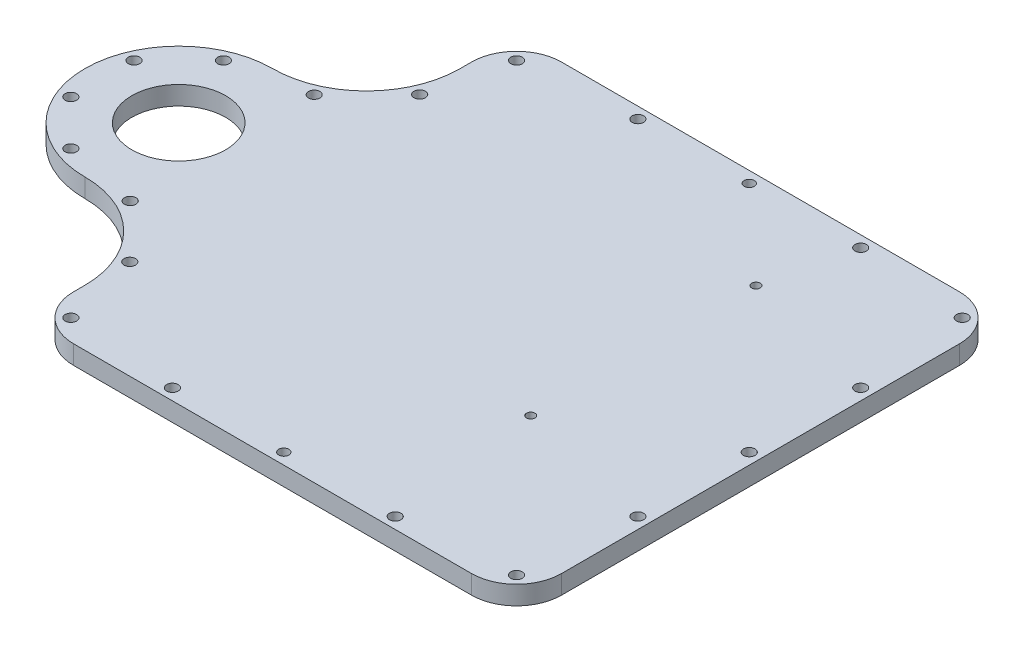
from build123d import *

# Parameters (mm, degrees)
BOSS_EXTRUDE1_DEPTH           = 4
BOSS_EXTRUDE1_DEPTH_BACK      = 1
FILLET1_START                 = -2
FILLET1_DEPTH                 = 7
FILLET1_START_2               = -1
FILLET1_2_DEPTH               = 5
SKETCH39_R                    = 12.5
CUT_EXTRUDE3_DEPTH            = 12.7
TAP_DRILL_FOR_4_40_TAP1_D     = 2.2606
TAP_DRILL_FOR_4_40_TAP1_DEPTH = 2.54
TAP_DRILL_FOR_4_40_TAP1_TIP   = 0.679152758
FILLET2_R                     = 12
SKETCH44_R                    = 1.524
SKETCH44_R_2                  = 1.35
CUT_EXTRUDE4_DEPTH            = 133.193040664
SKETCH47_R                    = 1.1303
CUT_EXTRUDE5_DEPTH            = 2.5


with BuildPart() as part:
    # Sketch1 → Boss-Extrude1 (new, two sides: drawn at the far end of the back side and taken through both)
    with BuildSketch(Plane(origin=(0, 0, 0), x_dir=(1, 0, 0), z_dir=(0, 1, 0)).offset(-BOSS_EXTRUDE1_DEPTH_BACK)):
        Polygon((-65, 25), (-65, 65), (65, 65), (65, -65), (-65, -65), (-65, -25), (-115, -25), (-115, 25), align=None)
    extrude(amount=BOSS_EXTRUDE1_DEPTH + BOSS_EXTRUDE1_DEPTH_BACK)

    # Fillet1: read off the stored shape, not the designer's step
    # Fillet1 outline → Fillet1 (cut)
    with BuildSketch(Plane(origin=(0, 0, 0), x_dir=(1, 0, 0), z_dir=(0, 1, 0)).offset(FILLET1_START)):
        with BuildLine():
            ThreePointArc((-90, -25), (-107.67766953, -17.67766953), (-115, 0))
            Line((-115, 0), (-115, -25))
            Line((-115, -25), (-90, -25))
        make_face()
        with BuildLine():
            ThreePointArc((-115, 0), (-107.67766953, 17.67766953), (-90, 25))
            Line((-90, 25), (-115, 25))
            Line((-115, 25), (-115, 0))
        make_face()
    extrude(amount=FILLET1_DEPTH, mode=Mode.SUBTRACT)

    # Fillet1 2 outline → Fillet1 2 (add)
    with BuildSketch(Plane(origin=(0, 0, 0), x_dir=(1, 0, 0), z_dir=(0, 1, 0)).offset(FILLET1_START_2)):
        with BuildLine():
            Line((-65, 25), (-65, 50))
            ThreePointArc((-65, 50), (-72.32233047, 32.32233047), (-90, 25))
            Line((-90, 25), (-65, 25))
        make_face()
        with BuildLine():
            Line((-65, -25), (-90, -25))
            ThreePointArc((-90, -25), (-72.32233047, -32.32233047), (-65, -50))
            Line((-65, -50), (-65, -25))
        make_face()
    extrude(amount=FILLET1_2_DEPTH)

    # Sketch39 → Cut-Extrude3 (cut)
    with BuildSketch(Plane.XZ.offset(1)):
        with Locations(Location((-90, 0, 0), (0, 0, 270))):
            Circle(SKETCH39_R)
    extrude(amount=-CUT_EXTRUDE3_DEPTH, mode=Mode.SUBTRACT)

    # Tap Drill for #4-40 Tap1
    with Locations(Plane(origin=(0, -1, 0), x_dir=(-1, 0, 0), z_dir=(0, -1, 0))):
        with Locations((90, -22), (74.443650814, -15.556349186), (68, 0), (74.443650814, 15.556349186), (90, 22), (105.556349186, 15.556349186), (112, 0), (105.556349186, -15.556349186)):
            Hole(TAP_DRILL_FOR_4_40_TAP1_D / 2, depth=TAP_DRILL_FOR_4_40_TAP1_DEPTH)
            with Locations((0, 0, -(TAP_DRILL_FOR_4_40_TAP1_DEPTH + TAP_DRILL_FOR_4_40_TAP1_TIP / 2))):  # 118° drill point
                Cone(0, TAP_DRILL_FOR_4_40_TAP1_D / 2, TAP_DRILL_FOR_4_40_TAP1_TIP, mode=Mode.SUBTRACT)

    # Fillet2
    fillet2_edges = [part.edges().sort_by_distance(p)[0] for p in [
        (65, 1.5, -65),
        (65, 1.5, 65),
        (-65, 1.5, 65),
        (-65, 1.5, -65),
    ]]
    fillet(fillet2_edges, radius=FILLET2_R)

    # Sketch44 → Cut-Extrude4 (cut, through all)
    with BuildSketch(Plane.XZ.offset(1)):
        with Locations(Location((-64.419035512, 38.615174316, 0), (0, 0, 270))):
            Circle(SKETCH44_R)
        with Locations(Location((-98.419035512, 20.325349715, 0), (0, 0, 270))):
            Circle(SKETCH44_R)
        with Locations(Location((-110.325349715, 8.419035512, 0), (0, 0, 270))):
            Circle(SKETCH44_R)
        with Locations(Location((-110.325349715, -8.419035512, 0), (0, 0, 270))):
            Circle(SKETCH44_R)
        with Locations(Location((-98.419035512, -20.325349715, 0), (0, 0, 270))):
            Circle(SKETCH44_R)
        with Locations(Location((-64.419035512, -38.615174316, 0), (0, 0, 270))):
            Circle(SKETCH44_R)
        with Locations(Location((-59.363961031, -59.363961031, 0), (0, 0, 270))):
            Circle(SKETCH44_R)
        with Locations(Location((-29.681980515, -62, 0), (0, 0, 270))):
            Circle(SKETCH44_R)
        with Locations(Location((0, -62, 0), (0, 0, 270))):
            Circle(SKETCH44_R_2)
        with Locations(Location((29.681980515, -62, 0), (0, 0, 270))):
            Circle(SKETCH44_R)
        with Locations(Location((59.363961031, -59.363961031, 0), (0, 0, 270))):
            Circle(SKETCH44_R)
        with Locations(Location((62, -29.681980515, 0), (0, 0, 270))):
            Circle(SKETCH44_R)
        with Locations(Location((62, 0, 0), (0, 0, 270))):
            Circle(SKETCH44_R)
        with Locations(Location((62, 29.681980515, 0), (0, 0, 270))):
            Circle(SKETCH44_R)
        with Locations(Location((59.363961031, 59.363961031, 0), (0, 0, 270))):
            Circle(SKETCH44_R)
        with Locations(Location((29.681980515, 62, 0), (0, 0, 270))):
            Circle(SKETCH44_R)
        with Locations(Location((0, 62, 0), (0, 0, 270))):
            Circle(SKETCH44_R_2)
        with Locations(Location((-29.681980515, 62, 0), (0, 0, 270))):
            Circle(SKETCH44_R)
        with Locations(Location((-59.363961031, 59.363961031, 0), (0, 0, 270))):
            Circle(SKETCH44_R)
        with Locations(Location((-78.419035512, -24.507231191, 0), (0, 0, 270))):
            Circle(SKETCH44_R)
        with Locations(Location((-78.419035512, 24.507231191, 0), (0, 0, 270))):
            Circle(SKETCH44_R)
    extrude(amount=-CUT_EXTRUDE4_DEPTH, mode=Mode.SUBTRACT)

    # Sketch47 → Cut-Extrude5 (cut)
    with BuildSketch(Plane(origin=(0, 4, 0), x_dir=(1, 0, 0), z_dir=(0, 1, 0))):
        with Locations(Location((24.46, -20.675, 0), (0, 0, 270))):
            Circle(SKETCH47_R)
        with Locations(Location((24.46, 39.325, 0), (0, 0, 270))):
            Circle(SKETCH47_R)
    extrude(amount=-CUT_EXTRUDE5_DEPTH, mode=Mode.SUBTRACT)


solid = part.part
